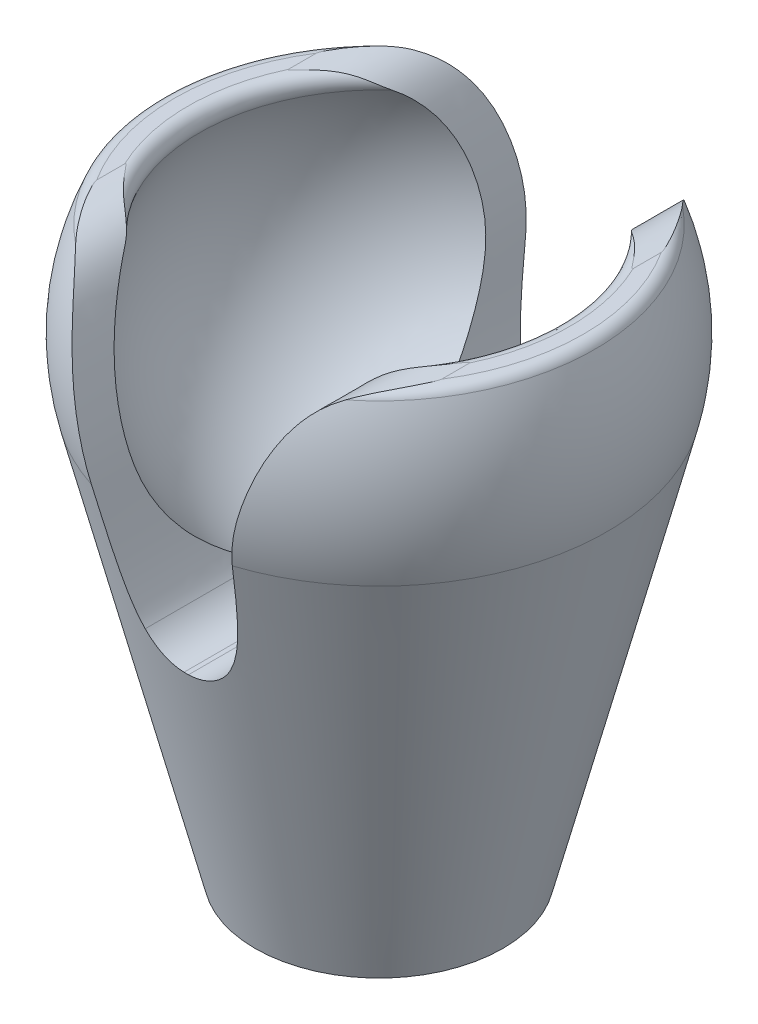
from build123d import *

# Parameters (mm, degrees)
SKETCH2_R          = 1.4
CUT_EXTRUDE1_DEPTH = 5
CUT_EXTRUDE2_DEPTH = 12.5


with BuildPart() as part:
    # Sketch1 → Revolve1 (revolve)
    with BuildSketch(Plane.XY):
        with BuildLine():
            Line((7.703125000000003, 4.093308396780739), (8.25155347589925, 4.09330839678074))
            ThreePointArc((8.25155347589925, 4.09330839678074), (8.525584384618687, 4.011527312022984), (8.709973113449209, 3.7929366410463374))
            ThreePointArc((8.709973113449209, 3.7929366410463374), (9.46833587707404, 0.7749940121785072), (9.210823123592052, -2.3260991780020928))
            Line((9.210823123592052, -2.3260991780020928), (5.000000000000002, -19))
            Line((5.000000000000002, -19), (1.35e-15, -19))
            Line((1.35e-15, -19), (0, -8))
            ThreePointArc((0, -8), (6.747425379985219, -4.297935637202041), (7.250000000000002, 3.3819373146171676))
            ThreePointArc((7.250000000000002, 3.3819373146171676), (7.281410913750926, 3.861929374105869), (7.703125000000003, 4.093308396780739))
        make_face()
    revolve(axis=Axis((0, -8, 0), (1.2e-16, -1, 0)))

    # Sketch2 → Cut-Extrude1 (cut)
    with BuildSketch(Plane.XZ.offset(19)):
        Circle(SKETCH2_R)
    extrude(amount=-CUT_EXTRUDE1_DEPTH, mode=Mode.SUBTRACT)

    # Sketch3 → Cut-Extrude2 (cut, symmetric)
    with BuildSketch(Plane.XY):
        with BuildLine():
            Line((6.960317415241078, 4.093308396780739), (-6.960317415241078, 4.0933083967807375))
            add(Edge.make_bspline(
                [(-1.6343595131568567, -7.2423164949330525), (-2.1651354994688856, -6.5729933366368005), (-2.926161575299065, -2.8973819936922793), (-2.6900425513197233, -1.6306618084287647), (-4.529058225393273, 3.651344731048627), (-5.9625934883572, 4.051634591324083), (-6.960317415241078, 4.0933083967807375)],
                knots=[0.06057299954953369, 0.06057299954953369, 0.06057299954953369, 0.06057299954953369, 0.23443084842952225, 0.6815674014769372, 0.8533919196535109, 1, 1, 1, 1], degree=3))
            ThreePointArc((-1.6343595131568567, -7.2423164949330525), (-0.947605664535429, -7.795462704184081), (-0.08971777988064458, -7.999496904179242))
            ThreePointArc((-0.08971777988064458, -7.999496904179242), (4.9e-16, -8), (0.08971777988064458, -7.999496904179242))
            ThreePointArc((0.08971777988064458, -7.999496904179242), (0.9476056645354287, -7.7954627041840805), (1.6343595131568567, -7.2423164949330525))
            add(Edge.make_bspline(
                [(1.6343595131568567, -7.2423164949330525), (2.1651354994688874, -6.5729933366368005), (2.926161575299067, -2.8973819936922776), (2.6900425513197233, -1.630661808428764), (4.529058225393274, 3.6513447310486282), (5.9625934883572, 4.051634591324085), (6.960317415241078, 4.093308396780739)],
                knots=[0.06057299954953369, 0.06057299954953369, 0.06057299954953369, 0.06057299954953369, 0.23443084842952225, 0.6815674014769372, 0.8533919196535109, 1, 1, 1, 1], degree=3))
        make_face()
    extrude(amount=CUT_EXTRUDE2_DEPTH, both=True, mode=Mode.SUBTRACT)


solid = part.part
